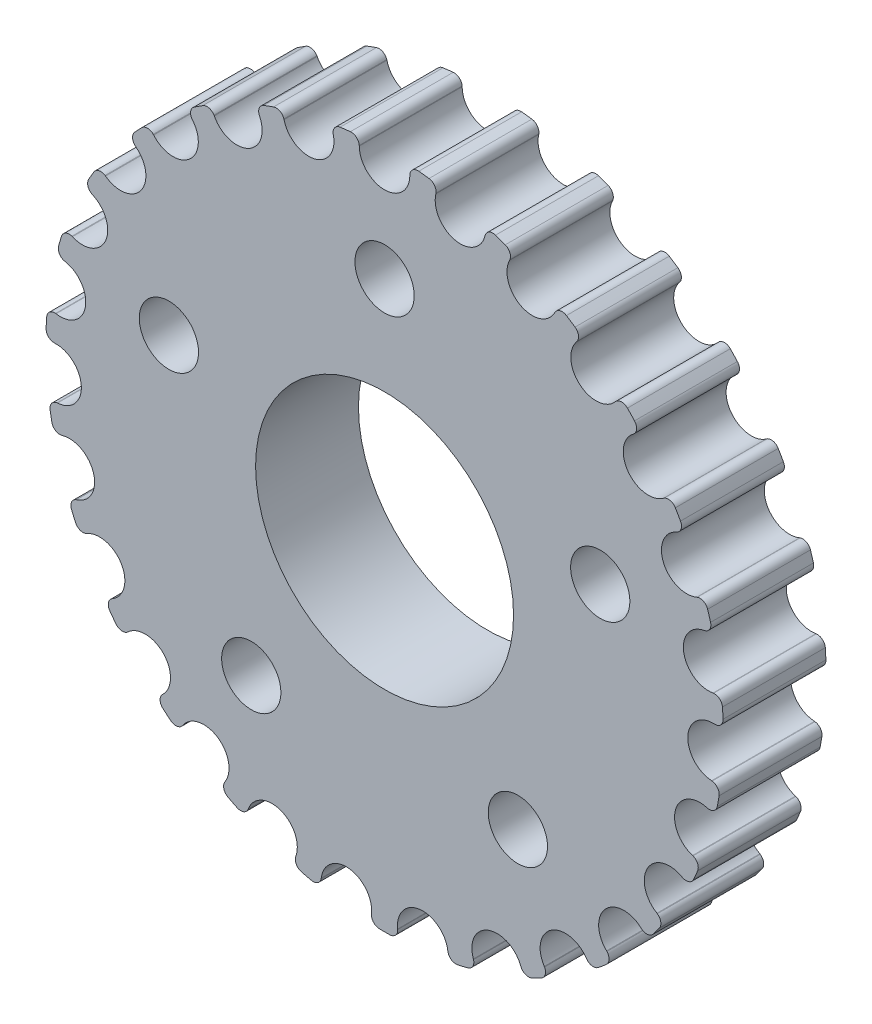
from build123d import *

# Parameters (mm, degrees)
SKETCH2_R                = 20.914417317
BOSS_EXTRUDE1_DEPTH      = 6.35
CUT_EXTRUDE1_DEPTH       = 31.251416553
FILLET1_R                = 0.5
CIRPATTERN1_COUNT        = 27
FILLET1_OF_CIRPATTERN1_R = 0.5
SKETCH4_R                = 7.9629
CUT_EXTRUDE2_DEPTH       = 31.238398104
F_6_CLEARANCE_HOLE1_D    = 3.6576
CIRPATTERN2_COUNT        = 5


with BuildPart() as part:
    # Sketch2 → Boss-Extrude1 (new body)
    with BuildSketch(Plane.XY):
        Circle(SKETCH2_R)
    extrude(amount=BOSS_EXTRUDE1_DEPTH)

    # Sketch3 → Cut-Extrude1 (cut, through all)
    with BuildSketch(Plane(origin=(0, 0, 0), x_dir=(-1, 0, 0), z_dir=(0, 0, -1))):
        with BuildLine():
            Line((-1.601360878, 20.853021246), (-1.56, 20.314417317))
            ThreePointArc((-1.56, 20.314417317), (0, 18.754417317), (1.56, 20.314417317))
            Line((1.56, 20.314417317), (1.601360878, 20.853021246))
            ThreePointArc((1.601360878, 20.853021246), (0, 20.914417317), (-1.601360878, 20.853021246))
        make_face()
    cut_extrude1 = extrude(amount=-CUT_EXTRUDE1_DEPTH, mode=Mode.SUBTRACT)

    # Fillet1
    fillet1_edges = [part.edges().sort_by_distance(p)[0] for p in [
        (-1.601360878, 20.853021246, 3.175),
        (1.601360878, 20.853021246, 3.175),
    ]]
    fillet(fillet1_edges, radius=FILLET1_R)

    # CirPattern1: Cut-Extrude1 ×27 about axis
    cirpattern1_axis = Axis((0, 0, 0), (0, 0, 1))
    for i in range(1, CIRPATTERN1_COUNT):
        add(cut_extrude1.rotate(cirpattern1_axis, i * 360 / CIRPATTERN1_COUNT), mode=Mode.SUBTRACT)

    # Fillet1 of CirPattern1
    fillet1_of_cirpattern1_edges = [part.edges().sort_by_distance(p)[0] for p in [
        (-6.36723364, 19.921626126, 3.175),
        (-3.250841664, 20.660224592, 3.175),
        (-10.789847189, 17.916250985, 3.175),
        (-7.927790491, 19.353629883, 3.175),
        (-14.630777283, 14.945006117, 3.175),
        (-12.177350079, 17.003675978, 3.175),
        (-17.682958387, 11.1680721, 3.175),
        (-15.770425574, 13.7370495, 3.175),
        (-19.781846626, 6.789064425, 3.175),
        (-18.513313343, 9.729855127, 3.175),
        (-20.814290395, 2.044056531, 3.175),
        (-20.258143598, 5.198121746, 3.175),
        (-20.72463038, -2.811146981, 3.175),
        (-20.910852088, 0.386156276, 3.175),
        (-19.517700177, -7.514800831, 3.175),
        (-20.43625113, -4.446626979, 3.175),
        (-17.258565705, -11.813329823, 3.175),
        (-18.859926583, -9.039691422, 3.175),
        (-14.06901749, -15.474999147, 3.175),
        (-16.266858513, -13.145423761, 3.175),
        (-10.121004899, -18.302407261, 3.175),
        (-12.796839889, -16.542482902, 3.175),
        (-5.627366315, -20.143127862, 3.175),
        (-8.636940315, -19.047732509, 3.175),
        (-0.830354957, -20.897927227, 3.175),
        (-4.011421053, -20.526113925, 3.175),
        (4.011421053, -20.526113925, 3.175),
        (0.830354957, -20.897927227, 3.175),
        (8.636940315, -19.047732509, 3.175),
        (5.627366315, -20.143127862, 3.175),
        (12.796839889, -16.542482902, 3.175),
        (10.121004899, -18.302407261, 3.175),
        (16.266858513, -13.145423761, 3.175),
        (14.06901749, -15.474999147, 3.175),
        (18.859926583, -9.039691422, 3.175),
        (17.258565705, -11.813329823, 3.175),
        (20.43625113, -4.446626979, 3.175),
        (19.517700177, -7.514800831, 3.175),
        (20.910852088, 0.386156276, 3.175),
        (20.72463038, -2.811146981, 3.175),
        (20.258143598, 5.198121746, 3.175),
        (20.814290395, 2.044056531, 3.175),
        (18.513313343, 9.729855127, 3.175),
        (19.781846626, 6.789064425, 3.175),
        (15.770425574, 13.7370495, 3.175),
        (17.682958387, 11.1680721, 3.175),
        (12.177350079, 17.003675978, 3.175),
        (14.630777283, 14.945006117, 3.175),
        (7.927790491, 19.353629883, 3.175),
        (10.789847189, 17.916250985, 3.175),
        (3.250841664, 20.660224592, 3.175),
        (6.36723364, 19.921626126, 3.175),
    ]]
    fillet(fillet1_of_cirpattern1_edges, radius=FILLET1_OF_CIRPATTERN1_R)

    # Sketch4 → Cut-Extrude2 (cut, through all)
    with BuildSketch(Plane.XY.offset(6.35)):
        Circle(SKETCH4_R)
    extrude(amount=-CUT_EXTRUDE2_DEPTH, mode=Mode.SUBTRACT)

    # #6 Clearance Hole1 (through all)
    with Locations(Plane.XY.offset(6.35)):
        with Locations((0, 14)):
            f_6_clearance_hole1 = Hole(F_6_CLEARANCE_HOLE1_D / 2)

    # CirPattern2: #6 Clearance Hole1 ×5 about axis
    cirpattern2_axis = Axis((0, 0, 6.35), (0, 0, 1))
    for i in range(1, CIRPATTERN2_COUNT):
        add(f_6_clearance_hole1.rotate(cirpattern2_axis, i * 360 / CIRPATTERN2_COUNT), mode=Mode.SUBTRACT)


solid = part.part
